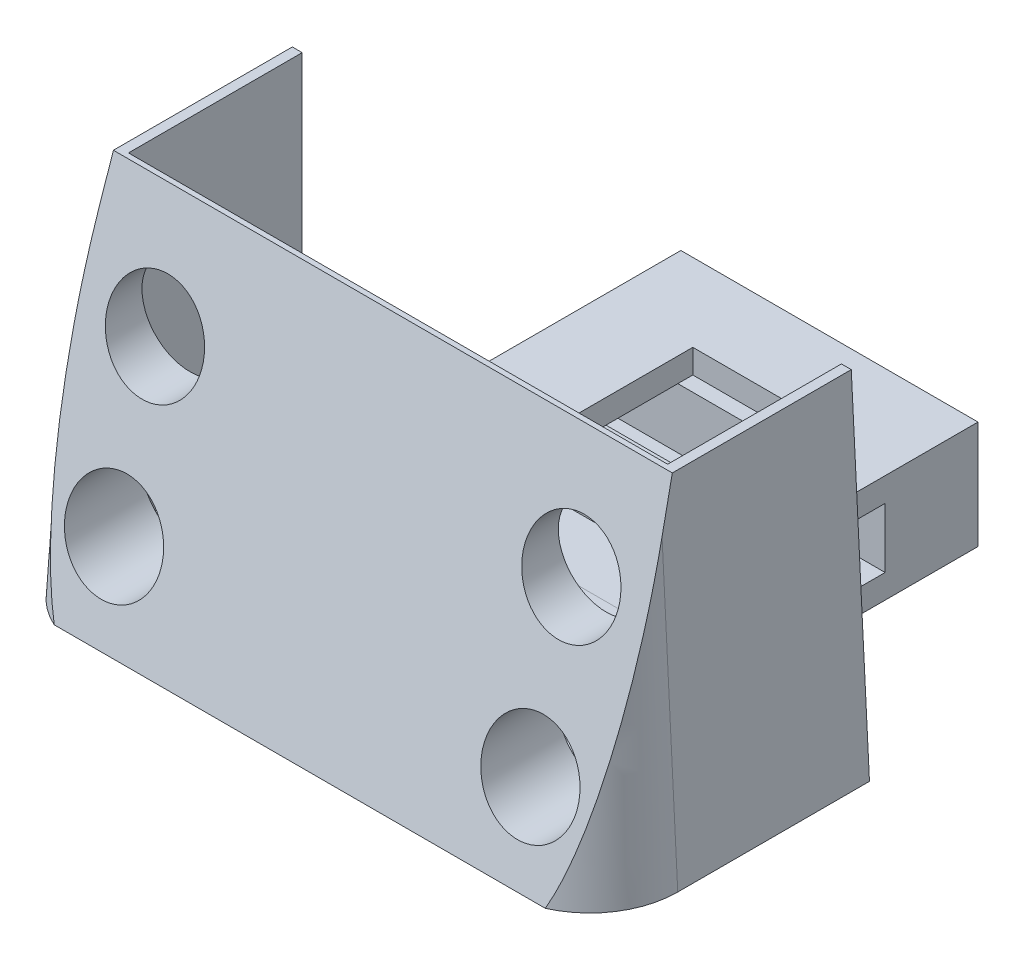
from build123d import *

# Parameters (mm, degrees)
BOSS_EXTRUDE1_DEPTH      = 10
SKETCH2_W                = 17.2
SKETCH2_H                = 43
CUT_EXTRUDE1_DEPTH       = 72.414284285
SKETCH3_W                = 90
SKETCH3_H                = 34
SKETCH3_W_2              = 80
SKETCH3_H_2              = 24
BOSS_EXTRUDE3_DEPTH      = 15
SKETCH4_W                = 49.6
SKETCH4_H                = 5
BOSS_EXTRUDE4_DEPTH      = 10
SKETCH5_W                = 15
SKETCH5_H                = 22
BOSS_EXTRUDE5_DEPTH      = 5
SKETCH6_W                = 90
SKETCH6_H                = 77
BOSS_EXTRUDE6_DEPTH      = 15
BOSS_EXTRUDE8_DEPTH      = 39
CHAMFER1_SIZE            = 64
CHAMFER1_SIZE_2          = 3.354097874
CHAMFER3_SIZE            = 64
CHAMFER3_SIZE_2          = 13.775745352
CUT_EXTRUDE6_DEPTH       = 2.5
CUT_EXTRUDE8_DEPTH       = 15
CUT_EXTRUDE9_DEPTH       = 15
SKETCH22_W               = 30
SKETCH22_H               = 7
CUT_EXTRUDE10_DEPTH      = 10
SKETCH25_R               = 8
CUT_EXTRUDE19_DEPTH      = 116.41230437
SKETCH29_W               = 9
SKETCH29_H               = 29
BOSS_EXTRUDE10_DEPTH     = 28
SKETCH31_W               = 49.6
SKETCH31_H               = 13
BOSS_EXTRUDE12_DEPTH     = 28
SKETCH30_W               = 49.6
SKETCH30_H               = 4
SKETCH30_W_2             = 48
BOSS_EXTRUDE11_DEPTH     = 10
SKETCH33_W               = 15
SKETCH33_H               = 19.5
BOSS_EXTRUDE13_DEPTH     = 13
SKETCH23_W               = 30
SKETCH23_H               = 28.995403325
CUT_EXTRUDE17_DEPTH      = 5
SKETCH34_W               = 9.8
SKETCH34_H               = 10.5
BOSS_EXTRUDE14_DEPTH     = 28
SKETCH35_W               = 30
SKETCH35_H               = 10.5
CUT_EXTRUDE22_DEPTH      = 5
SKETCH37_W               = 30
SKETCH37_H               = 32.5
BOSS_EXTRUDE15_DEPTH     = 5
SKETCH38_W               = 100
SKETCH38_H               = 20
CUT_EXTRUDE23_DEPTH      = 64
SKETCH39_W               = 8
SKETCH39_H               = 43
CUT_EXTRUDE24_DEPTH      = 64
CUT_EXTRUDE25_REACH      = 111.873
SKETCH40_W               = 23
SKETCH40_H               = 22
CUT_EXTRUDE26_DEPTH      = 62
SKETCH42_W               = 48
SKETCH42_H               = 29
CUT_EXTRUDE27_DEPTH      = 28
CUT_EXTRUDE28_DEPTH      = 111.413042708
CUT_EXTRUDE28_DEPTH_BACK = 111.413042708
SKETCH43_W               = 90
SKETCH43_H               = 6
CUT_EXTRUDE29_DEPTH      = 110.488551462
CUT_EXTRUDE29_DEPTH_BACK = 110.488551462
SKETCH44_W               = 43
SKETCH44_H               = 24
SKETCH45_W               = 30
SKETCH45_H               = 7
BOSS_EXTRUDE16_DEPTH     = 4
SKETCH46_W               = 49.6
SKETCH46_H               = 10.5
CUT_EXTRUDE30_DEPTH      = 14
SPLIT1_SURFACE_1_BACK    = 146.104
SPLIT1_SURFACE_1_DEPTH   = 292.208
SPLIT1_SURFACE_2_BACK    = 146.104
SPLIT1_SURFACE_2_DEPTH   = 292.208


with BuildPart() as part:
    # Sketch1 → Boss-Extrude1 (new body)
    with BuildSketch(Plane(origin=(0, 0, 0), x_dir=(1, 0, 0), z_dir=(0, 1, 0))):
        with BuildLine():
            Line((-35, 50), (35, 50))
            ThreePointArc((35, 50), (45.606601718, 45.606601718), (50, 35))
            Line((50, 35), (50, -35))
            ThreePointArc((50, -35), (45.606601718, -45.606601718), (35, -50))
            Line((35, -50), (-35, -50))
            ThreePointArc((-35, -50), (-45.606601718, -45.606601718), (-50, -35))
            Line((-50, -35), (-50, 35))
            ThreePointArc((-50, 35), (-45.606601718, 45.606601718), (-35, 50))
        make_face()
    extrude(amount=BOSS_EXTRUDE1_DEPTH)

    # Sketch2 → Cut-Extrude1 (cut, through all)
    with BuildSketch(Plane(origin=(0, 10, 0), x_dir=(1, 0, 0), z_dir=(0, 1, 0))):
        with Locations((-33.4, 18.5)):
            Rectangle(SKETCH2_W, SKETCH2_H)
        with Locations((33.4, 18.5)):
            Rectangle(SKETCH2_W, SKETCH2_H)
    extrude(amount=-CUT_EXTRUDE1_DEPTH, mode=Mode.SUBTRACT)

    # Sketch3 → Boss-Extrude3 (add)
    with BuildSketch(Plane(origin=(0, 10, 0), x_dir=(1, 0, 0), z_dir=(0, 1, 0))):
        with Locations((0, -20)):
            Rectangle(SKETCH3_W, SKETCH3_H)
        with Locations((0, -20)):
            Rectangle(SKETCH3_W_2, SKETCH3_H_2, mode=Mode.SUBTRACT)
    extrude(amount=BOSS_EXTRUDE3_DEPTH)

    # Sketch4 → Boss-Extrude4 (add)
    with BuildSketch(Plane(origin=(0, 10, 0), x_dir=(1, 0, 0), z_dir=(0, 1, 0))):
        with Locations((0, 10)):
            Rectangle(SKETCH4_W, SKETCH4_H)
        with Locations((0, 27)):
            Rectangle(SKETCH4_W, SKETCH4_H)
    extrude(amount=BOSS_EXTRUDE4_DEPTH)

    # Sketch5 → Boss-Extrude5 (add)
    with BuildSketch(Plane(origin=(0, 20, 0), x_dir=(1, 0, 0), z_dir=(0, 1, 0))):
        with Locations((-17.3, 18.5)):
            Rectangle(SKETCH5_W, SKETCH5_H)
        with Locations((17.3, 18.5)):
            Rectangle(SKETCH5_W, SKETCH5_H)
    extrude(amount=BOSS_EXTRUDE5_DEPTH)

    # Sketch6 → Boss-Extrude6 (add)
    with BuildSketch(Plane(origin=(0, 10, 0), x_dir=(1, 0, 0), z_dir=(0, 1, 0))):
        with BuildLine():
            Line((-50, 35), (-50, -35))
            ThreePointArc((-50, -35), (-45.606601718, -45.606601718), (-35, -50))
            Line((-35, -50), (35, -50))
            ThreePointArc((35, -50), (45.606601718, -45.606601718), (50, -35))
            Line((50, -35), (50, 35))
            ThreePointArc((50, 35), (45.606601718, 45.606601718), (35, 50))
            Line((35, 50), (-35, 50))
            ThreePointArc((-35, 50), (-45.606601718, 45.606601718), (-50, 35))
        make_face()
        with Locations((0, 1.5)):
            Rectangle(SKETCH6_W, SKETCH6_H, mode=Mode.SUBTRACT)
    extrude(amount=BOSS_EXTRUDE6_DEPTH)

    # Sketch9 → Boss-Extrude8 (add)
    with BuildSketch(Plane(origin=(0, 25, 0), x_dir=(1, 0, 0), z_dir=(0, 1, 0))):
        with BuildLine():
            Line((-50, 35), (-50, -35))
            ThreePointArc((-50, -35), (-45.606601718, -45.606601718), (-35, -50))
            Line((-35, -50), (35, -50))
            ThreePointArc((35, -50), (45.606601718, -45.606601718), (50, -35))
            Line((50, -35), (50, 35))
            ThreePointArc((50, 35), (45.606601718, 45.606601718), (35, 50))
            Line((35, 50), (-35, 50))
            ThreePointArc((-35, 50), (-45.606601718, 45.606601718), (-50, 35))
        make_face()
        with BuildLine():
            Line((-45, 35), (-45, -32))
            Line((-45, -32), (45, -32))
            Line((45, -32), (45, 35))
            ThreePointArc((45, 35), (44.659258263, 37.588190451), (43.660254038, 40))
            Line((43.660254038, 40), (-43.660254038, 40))
            ThreePointArc((-43.660254038, 40), (-44.659258263, 37.588190451), (-45, 35))
        make_face(mode=Mode.SUBTRACT)
    extrude(amount=BOSS_EXTRUDE8_DEPTH)

    # Chamfer1
    # the kernel refuses this chamfer: 64, 3.354097874 mm, written as the material it takes off along each edge
    with BuildSketch(Plane(origin=(-35, 64, 50), x_dir=(0, -0.9999979738662979, 0.002013023422382214), z_dir=(1, 0, 0)), Plane(origin=(50, 64, 35), x_dir=(0.002013023422382214, -0.9999979738662979, 0), z_dir=(0, 0, -1)), Plane(origin=(-50, 64, -35), x_dir=(-0.002013023422382214, -0.9999979738662979, 0), z_dir=(0, 0, 1)), Plane(origin=(35, 64, -50), x_dir=(0, -0.9999979738662979, -0.002013023422382214), z_dir=(-1, 0, 0))) as chamfer1_piece_1:
        Polygon((CHAMFER1_SIZE * 0.999997973866, CHAMFER1_SIZE * 0.00201302342238), (-CHAMFER1_SIZE_2 * 0.00201302342245, CHAMFER1_SIZE_2 * 0.9999979739), (0, 0), align=None)
    extrude(amount=70, mode=Mode.SUBTRACT)
    with BuildSketch(Plane(origin=(35, 64, 35), x_dir=(0, 0, 1), z_dir=(-1, 0, 0))) as chamfer1_piece_2:
        Polygon((15, -CHAMFER1_SIZE), (15 - CHAMFER1_SIZE_2, 0), (15, 0), align=None)
    revolve(axis=Axis((35, 64, 35), (0, 1, 0)), revolution_arc=90, mode=Mode.SUBTRACT)
    with BuildSketch(Plane(origin=(-35, 64, 35), x_dir=(-1, 0, 0), z_dir=(0, 0, -1))) as chamfer1_piece_3:
        Polygon((15, -CHAMFER1_SIZE), (15 - CHAMFER1_SIZE_2, 0), (15, 0), align=None)
    revolve(axis=Axis((-35, 64, 35), (0, 1, 0)), revolution_arc=90, mode=Mode.SUBTRACT)
    with BuildSketch(Plane(origin=(35, 64, -35), x_dir=(1, 0, 0), z_dir=(0, 0, 1))) as chamfer1_piece_4:
        Polygon((15, -CHAMFER1_SIZE), (15 - CHAMFER1_SIZE_2, 0), (15, 0), align=None)
    revolve(axis=Axis((35, 64, -35), (0, 1, 0)), revolution_arc=90, mode=Mode.SUBTRACT)
    with BuildSketch(Plane(origin=(-35, 64, -35), x_dir=(0, 0, -1), z_dir=(1, 0, 0))) as chamfer1_piece_5:
        Polygon((15 - CHAMFER1_SIZE_2, 0), (15, -CHAMFER1_SIZE), (15, 0), align=None)
    revolve(axis=Axis((-35, 64, -35), (0, 1, 0)), revolution_arc=90, mode=Mode.SUBTRACT)

    # Chamfer3
    # the kernel refuses this chamfer: 64, 13.775745352 mm, written as the material it takes off along each edge
    with BuildSketch(Plane(origin=(-201.265469314, 64, 46.645902126), x_dir=(0, -0.9981787050157903, 0.06032638604292662), z_dir=(1, 0, 0))) as chamfer3_piece_1:
        Polygon((CHAMFER3_SIZE * 0.999967974892, CHAMFER3_SIZE * 0.00800307379952), (-CHAMFER3_SIZE_2 * 0.060326386045, CHAMFER3_SIZE_2 * 0.99817870505), (0, 0), align=None)
    extrude(amount=402.530938629, mode=Mode.SUBTRACT)

    # Sketch17 → Cut-Extrude6 (cut)
    with BuildSketch(Plane(origin=(0, 0, -29.5), x_dir=(-1, 0, 0), z_dir=(0, 0, -1))):
        Polygon((-24.8, 10), (24.8, 10), (24.8, 25), (9.8, 25), (9.8, 20), (-9.8, 20), (-9.8, 25), (-24.8, 25), align=None)
    extrude(amount=-CUT_EXTRUDE6_DEPTH, mode=Mode.SUBTRACT)

    # Sketch20 → Cut-Extrude8 (cut)
    with BuildSketch(Plane.XZ.offset(-25)):
        with BuildLine():
            Line((-45, -35), (-45, -40))
            Line((-45, -40), (-43.660254038, -40))
            ThreePointArc((-43.660254038, -40), (-44.659258263, -37.588190451), (-45, -35))
        make_face()
        with BuildLine():
            Line((45, -40), (45, -35))
            ThreePointArc((45, -35), (44.659258263, -37.588190451), (43.660254038, -40))
            Line((43.660254038, -40), (45, -40))
        make_face()
    extrude(amount=-CUT_EXTRUDE8_DEPTH, mode=Mode.SUBTRACT)

    # Sketch21 → Cut-Extrude9 (cut)
    with BuildSketch(Plane(origin=(0, 25, 0), x_dir=(1, 0, 0), z_dir=(0, 1, 0))):
        Polygon((40, -8), (40, -32), (45, -32), (45, -3), (-45, -3), (-45, -32), (-40, -32), (-40, -8), align=None)
    extrude(amount=-CUT_EXTRUDE9_DEPTH, mode=Mode.SUBTRACT)

    # Sketch22 → Cut-Extrude10 (cut)
    with BuildSketch(Plane.XZ):
        with Locations((0, 28.5)):
            Rectangle(SKETCH22_W, SKETCH22_H)
    extrude(amount=-CUT_EXTRUDE10_DEPTH, mode=Mode.SUBTRACT)

    # Sketch25 → Cut-Extrude19 (cut, through all)
    with BuildSketch(Plane(origin=(0, 0, 32), x_dir=(-1, 0, 0), z_dir=(0, 0, -1))):
        with Locations((-34.75, 45.5)):
            Circle(SKETCH25_R)
        with Locations((34.75, 45.5)):
            Circle(SKETCH25_R)
        with Locations((-34.75, 20)):
            Circle(SKETCH25_R)
        with Locations((34.75, 20)):
            Circle(SKETCH25_R)
    extrude(amount=-CUT_EXTRUDE19_DEPTH, mode=Mode.SUBTRACT)

    # Sketch29 → Boss-Extrude10 (add)
    with BuildSketch(Plane(origin=(0, 10, 0), x_dir=(1, 0, 0), z_dir=(0, 1, 0))):
        with Locations((-19.5, -17.5)):
            Rectangle(SKETCH29_W, SKETCH29_H)
        with Locations((19.5, -17.5)):
            Rectangle(SKETCH29_W, SKETCH29_H)
    extrude(amount=BOSS_EXTRUDE10_DEPTH)

    # Sketch31 → Boss-Extrude12 (add)
    with BuildSketch(Plane(origin=(0, 10, 0), x_dir=(1, 0, 0), z_dir=(0, 1, 0))):
        with Locations((0, 33.5)):
            Rectangle(SKETCH31_W, SKETCH31_H)
    extrude(amount=BOSS_EXTRUDE12_DEPTH)

    # Sketch30 → Boss-Extrude11 (add)
    with BuildSketch(Plane(origin=(0, 38, 0), x_dir=(1, 0, 0), z_dir=(0, 1, 0))):
        with Locations((0, 38)):
            Rectangle(SKETCH30_W, SKETCH30_H)
        with Locations((0, -20)):
            Rectangle(SKETCH30_W_2, SKETCH30_H)
    extrude(amount=BOSS_EXTRUDE11_DEPTH)

    # Sketch33 → Boss-Extrude13 (add)
    with BuildSketch(Plane(origin=(0, 25, 0), x_dir=(1, 0, 0), z_dir=(0, 1, 0))):
        with Locations((17.3, 17.25)):
            Rectangle(SKETCH33_W, SKETCH33_H)
        with Locations((-17.3, 17.25)):
            Rectangle(SKETCH33_W, SKETCH33_H)
    extrude(amount=BOSS_EXTRUDE13_DEPTH)

    # Sketch23 → Cut-Extrude17 (cut)
    with BuildSketch(Plane(origin=(0, 10, 0), x_dir=(1, 0, 0), z_dir=(0, 1, 0))):
        with Locations((0, -17.497701662)):
            Rectangle(SKETCH23_W, SKETCH23_H)
    extrude(amount=-CUT_EXTRUDE17_DEPTH, mode=Mode.SUBTRACT)

    # Sketch34 → Boss-Extrude14 (add)
    with BuildSketch(Plane(origin=(0, 10, 0), x_dir=(1, 0, 0), z_dir=(0, 1, 0))):
        with Locations((-19.9, 2.25)):
            Rectangle(SKETCH34_W, SKETCH34_H)
        with Locations((19.9, 2.25)):
            Rectangle(SKETCH34_W, SKETCH34_H)
    extrude(amount=BOSS_EXTRUDE14_DEPTH)

    # Sketch35 → Cut-Extrude22 (cut)
    with BuildSketch(Plane(origin=(0, 10, 0), x_dir=(1, 0, 0), z_dir=(0, 1, 0))):
        with Locations((0, 2.25)):
            Rectangle(SKETCH35_W, SKETCH35_H)
    extrude(amount=-CUT_EXTRUDE22_DEPTH, mode=Mode.SUBTRACT)

    # Sketch37 → Boss-Extrude15 (add)
    with BuildSketch(Plane(origin=(0, 5, 0), x_dir=(1, 0, 0), z_dir=(0, 1, 0))):
        with Locations((0, -8.75)):
            Rectangle(SKETCH37_W, SKETCH37_H)
    extrude(amount=BOSS_EXTRUDE15_DEPTH)

    # Sketch38 → Cut-Extrude23 (cut)
    with BuildSketch(Plane(origin=(0, 64, 0), x_dir=(1, 0, 0), z_dir=(0, 1, 0))):
        with Locations((0, 50)):
            Rectangle(SKETCH38_W, SKETCH38_H)
    extrude(amount=-CUT_EXTRUDE23_DEPTH, mode=Mode.SUBTRACT)

    # Sketch39 → Cut-Extrude24 (cut)
    with BuildSketch(Plane.XZ):
        with Locations((-46, -18.5)):
            Rectangle(SKETCH39_W, SKETCH39_H)
        with Locations((46, -18.5)):
            Rectangle(SKETCH39_W, SKETCH39_H)
    extrude(amount=-CUT_EXTRUDE24_DEPTH, mode=Mode.SUBTRACT)

    # Cut-Extrude25: up to this face of the body (flat: up to its plane)
    cut_extrude25_end = Plane(part.part.faces().sort_by_distance((24, 24.892018779, 17.617370892))[0])
    # Sketch40 → Cut-Extrude25 (cut, up to the picked face)
    with BuildSketch(Plane.ZY.offset(24), mode=Mode.PRIVATE) as cut_extrude25_sk1:
        with Locations((17.5, 24)):
            Rectangle(SKETCH40_W, SKETCH40_H)
    cut_extrude25_tool1 = split(extrude(cut_extrude25_sk1.sketch, amount=-CUT_EXTRUDE25_REACH, mode=Mode.PRIVATE), bisect_by=cut_extrude25_end, keep=Keep.BOTH, mode=Mode.PRIVATE)
    add(cut_extrude25_tool1.solids().sort_by(Axis((-24, 24, 17.5), (1, 0, 0)))[0], mode=Mode.SUBTRACT)

    # Sketch41 → Cut-Extrude26 (cut)
    with BuildSketch(Plane.XY.offset(22)):
        Polygon((-24, 38), (-15, 38), (15, 38), (24, 38), (24, 48), (-24, 48), align=None)
    extrude(amount=-CUT_EXTRUDE26_DEPTH, mode=Mode.SUBTRACT)

    # Sketch42 → Cut-Extrude27 (cut)
    with BuildSketch(Plane(origin=(0, 38, 0), x_dir=(1, 0, 0), z_dir=(0, 1, 0))):
        with Locations((0, -17.5)):
            Rectangle(SKETCH42_W, SKETCH42_H)
    extrude(amount=-CUT_EXTRUDE27_DEPTH, mode=Mode.SUBTRACT)

    # Sketch43 → Cut-Extrude28 (cut, two sides: drawn at the far end of the back side and taken through both)
    with BuildSketch(Plane(origin=(24.8, 0, 0), x_dir=(0, 0, -1), z_dir=(1, 0, 0)).offset(-CUT_EXTRUDE28_DEPTH_BACK)):
        with Locations((-5, 3)):
            Rectangle(SKETCH43_W, SKETCH43_H)
    extrude(amount=CUT_EXTRUDE28_DEPTH + CUT_EXTRUDE28_DEPTH_BACK, mode=Mode.SUBTRACT)

    # Sketch44 → Cut-Extrude29 (cut, two sides: drawn at the far end of the back side and taken through both)
    with BuildSketch(Plane(origin=(24.8, 0, 0), x_dir=(0, 0, -1), z_dir=(1, 0, 0)).offset(-CUT_EXTRUDE29_DEPTH_BACK)):
        with Locations((18.5, 36)):
            Rectangle(SKETCH44_W, SKETCH44_H)
    extrude(amount=CUT_EXTRUDE29_DEPTH + CUT_EXTRUDE29_DEPTH_BACK, mode=Mode.SUBTRACT)

    # Sketch45 → Boss-Extrude16 (add)
    with BuildSketch(Plane(origin=(0, 10, 0), x_dir=(1, 0, 0), z_dir=(0, 1, 0))):
        with Locations((0, -28.5)):
            Rectangle(SKETCH45_W, SKETCH45_H)
    extrude(amount=-BOSS_EXTRUDE16_DEPTH)

    # Sketch46 → Cut-Extrude30 (cut)
    with BuildSketch(Plane(origin=(0, 24, 0), x_dir=(1, 0, 0), z_dir=(0, 1, 0))):
        with Locations((0, 2.25)):
            Rectangle(SKETCH46_W, SKETCH46_H)
    extrude(amount=-CUT_EXTRUDE30_DEPTH, mode=Mode.SUBTRACT)


with BuildPart() as body_2:
    # Split1: the piece behind the surface
    add(part.part)
    # Split1 surface: a surface, the sketch's curves swept straight by 292.208 mm
    with BuildLine(Plane(origin=(0, 10, 0), x_dir=(1, 0, 0), z_dir=(0, 1, 0)).offset(-SPLIT1_SURFACE_1_BACK), mode=Mode.PRIVATE) as split1_surface_1_path:
        Line((-24.8, -3), (24.8, -3))
    split1_surface_1 = Shell.extrude(split1_surface_1_path.wire(), (0 * SPLIT1_SURFACE_1_DEPTH, 1 * SPLIT1_SURFACE_1_DEPTH, 0 * SPLIT1_SURFACE_1_DEPTH))
    split(bisect_by=split1_surface_1, keep=Keep.BOTTOM)


with BuildPart() as part_1:
    add(part.part)

    # Split1: split by a surface, the side it looks to stays
    # Split1 surface: a surface, the sketch's curves swept straight by 292.208 mm
    with BuildLine(Plane(origin=(0, 10, 0), x_dir=(1, 0, 0), z_dir=(0, 1, 0)).offset(-SPLIT1_SURFACE_2_BACK), mode=Mode.PRIVATE) as split1_surface_2_path:
        Line((-24.8, -3), (24.8, -3))
    split1_surface_2 = Shell.extrude(split1_surface_2_path.wire(), (0 * SPLIT1_SURFACE_2_DEPTH, 1 * SPLIT1_SURFACE_2_DEPTH, 0 * SPLIT1_SURFACE_2_DEPTH))
    split(bisect_by=split1_surface_2, keep=Keep.TOP)


solid = Compound([body_2.part, part_1.part])
